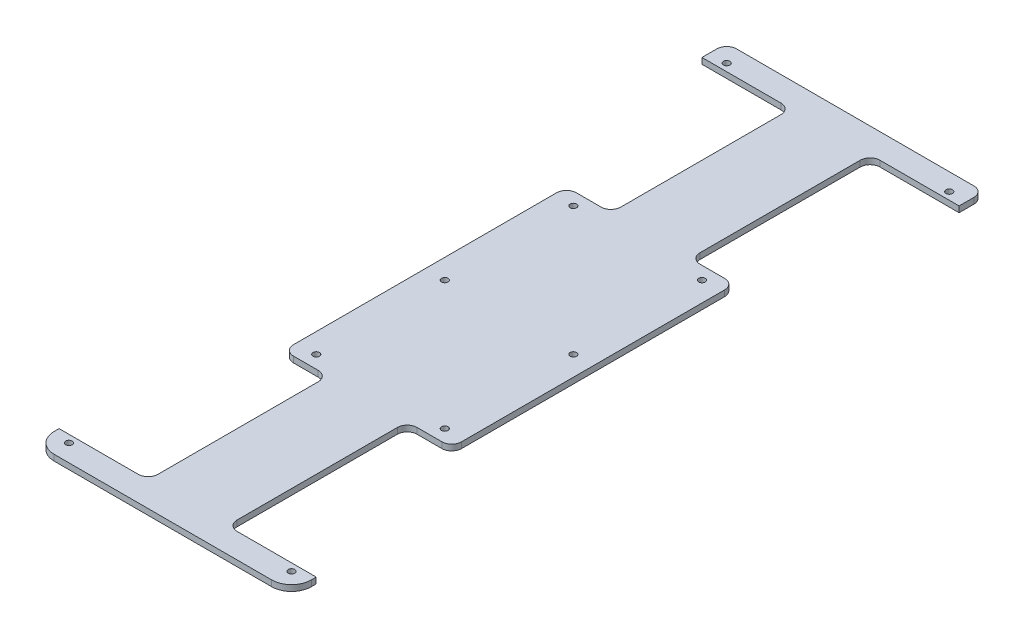
from build123d import *

# Parameters (mm, degrees)
BOSS_EXTRUDE1_DEPTH = 3
FILLET1_R           = 10
FILLET2_R           = 5
SKETCH2_R           = 1.65
CUT_EXTRUDE1_DEPTH  = 374.375146468
SKETCH3_R           = 1.65
CUT_EXTRUDE2_DEPTH  = 374.375146468
SKETCH4_R           = 1.65
CUT_EXTRUDE3_DEPTH  = 374.375146468
FILLET3_R           = 5


with BuildPart() as part:
    # Sketch1 → Boss-Extrude1 (new body)
    with BuildSketch(Plane(origin=(0, 0, 0), x_dir=(1, 0, 0), z_dir=(0, 1, 0))):
        Polygon((0, 0), (130, 0), (130, 12.5), (85, 12.5), (85, 103.5), (107.5, 103.5), (107.5, 246.5), (85, 246.5), (85, 337.5), (130, 337.5), (130, 350), (0, 350), (0, 337.5), (45, 337.5), (45, 246.5), (22.5, 246.5), (22.5, 103.5), (45, 103.5), (45, 12.5), (0, 12.5), align=None)
    extrude(amount=BOSS_EXTRUDE1_DEPTH)

    # Fillet1
    fillet1_edges = [part.edges().sort_by_distance(p)[0] for p in [
        (130, 1.5, 0),
        (0, 1.5, 0),
    ]]
    fillet(fillet1_edges, radius=FILLET1_R)

    # Fillet2
    fillet2_edges = [part.edges().sort_by_distance(p)[0] for p in [
        (0, 1.5, -350),
        (130, 1.5, -350),
        (107.5, 1.5, -246.5),
        (107.5, 1.5, -103.5),
        (22.5, 1.5, -103.5),
        (22.5, 1.5, -246.5),
    ]]
    fillet(fillet2_edges, radius=FILLET2_R)

    # Sketch2 → Cut-Extrude1 (cut, through all)
    with BuildSketch(Plane(origin=(0, 3, 0), x_dir=(1, 0, 0), z_dir=(0, 1, 0))):
        with Locations((32.5, 240)):
            Circle(SKETCH2_R)
        with Locations((32.5, 175)):
            Circle(SKETCH2_R)
        with Locations((32.5, 110)):
            Circle(SKETCH2_R)
        with Locations((97.5, 110)):
            Circle(SKETCH2_R)
        with Locations((97.5, 175)):
            Circle(SKETCH2_R)
        with Locations((97.5, 240)):
            Circle(SKETCH2_R)
    extrude(amount=-CUT_EXTRUDE1_DEPTH, mode=Mode.SUBTRACT)

    # Sketch3 → Cut-Extrude2 (cut, through all)
    with BuildSketch(Plane(origin=(0, 3, 0), x_dir=(1, 0, 0), z_dir=(0, 1, 0))):
        with Locations((8.75, 8.75)):
            Circle(SKETCH3_R)
        with Locations((121.25, 8.75)):
            Circle(SKETCH3_R)
    extrude(amount=-CUT_EXTRUDE2_DEPTH, mode=Mode.SUBTRACT)

    # Sketch4 → Cut-Extrude3 (cut, through all)
    with BuildSketch(Plane(origin=(0, 3, 0), x_dir=(1, 0, 0), z_dir=(0, 1, 0))):
        with Locations((8.75, 341.25)):
            Circle(SKETCH4_R)
        with Locations((121.25, 341.25)):
            Circle(SKETCH4_R)
    extrude(amount=-CUT_EXTRUDE3_DEPTH, mode=Mode.SUBTRACT)

    # Fillet3
    fillet3_edges = [part.edges().sort_by_distance(p)[0] for p in [
        (85, 1.5, -246.5),
        (45, 1.5, -246.5),
        (85, 1.5, -103.5),
        (45, 1.5, -103.5),
        (45, 1.5, -12.5),
        (85, 1.5, -12.5),
        (45, 1.5, -337.5),
        (85, 1.5, -337.5),
    ]]
    fillet(fillet3_edges, radius=FILLET3_R)


solid = part.part
